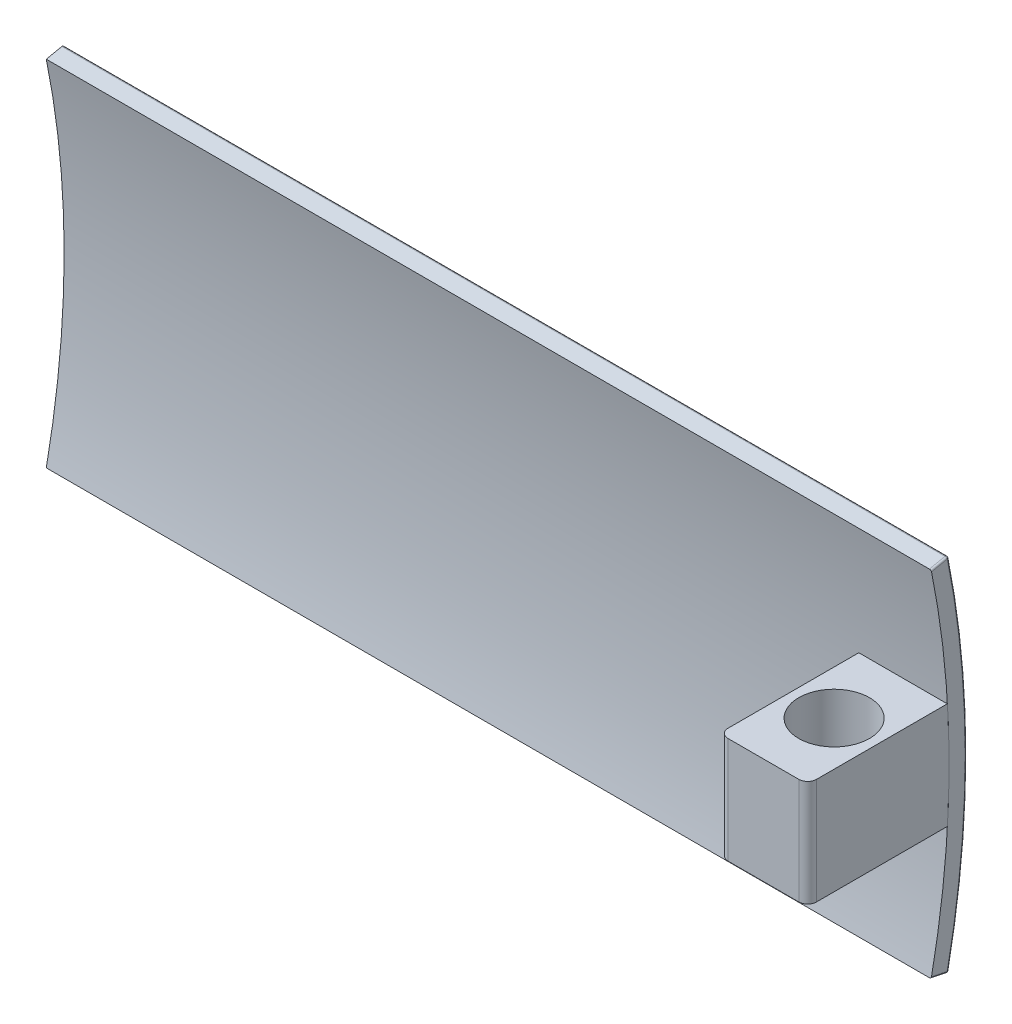
from build123d import *

# Parameters (mm, degrees)
BOSS_EXTRUDE1_DEPTH     = 50
FILLET3_R               = 0.1
BOSS_EXTRUDE2_DEPTH     = 5
CUT_EXTRUDE1_DEPTH      = 73.143420695
CUT_EXTRUDE1_DEPTH_BACK = 73.143420695
CUTOUT_HINGE_R          = 2
FILLET4_R               = 0.5


with BuildPart() as part:
    # airflap → Boss-Extrude1 (new body)
    with BuildSketch(Plane(origin=(0, 0, 0), x_dir=(0, 0, -1), z_dir=(1, 0, 0))):
        with BuildLine():
            Line((49.969590753, 10.2), (48.989794856, 10))
            ThreePointArc((48.989794856, 10), (50, 0), (48.989794856, -10))
            Line((48.989794856, -10), (49.969590753, -10.2))
            ThreePointArc((49.969590753, -10.2), (51, 0), (49.969590753, 10.2))
        make_face()
    extrude(amount=BOSS_EXTRUDE1_DEPTH)

    # Fillet3
    fillet3_edges = [part.edges().sort_by_distance(p)[0] for p in [
        (50, 10.1, -49.479692804),
        (50, -10.1, -49.479692804),
        (25, -10.2, -49.969590753),
        (25, 10.2, -49.969590753),
        (50, 0, -51),
    ]]
    fillet(fillet3_edges, radius=FILLET3_R)


with BuildPart() as body_2:
    # inner-hinge → Boss-Extrude2 (new body)
    with BuildSketch(Plane(origin=(50, 0, 0), x_dir=(0, 0, -1), z_dir=(1, 0, 0))):
        with BuildLine():
            Line((49.009696876, 3), (42.009696876, 3))
            Line((42.009696876, 3), (42.009696876, -3))
            Line((42.009696876, -3), (49.009696876, -3))
            Line((49.009696876, -3), (49.909918854, -3))
            ThreePointArc((49.909918854, -3), (50, 0), (49.909918854, 3))
            Line((49.909918854, 3), (49.009696876, 3))
        make_face()
    extrude(amount=-BOSS_EXTRUDE2_DEPTH)

    # cutout-hinge → Cut-Extrude1 (cut, two sides: drawn at the far end of the back side and taken through both)
    with BuildSketch(Plane(origin=(0, 0, 0), x_dir=(1, 0, 0), z_dir=(0, 1, 0)).offset(-CUT_EXTRUDE1_DEPTH_BACK)):
        with Locations((47.5, 46.004848438)):
            Circle(CUTOUT_HINGE_R)
    extrude(amount=CUT_EXTRUDE1_DEPTH + CUT_EXTRUDE1_DEPTH_BACK, mode=Mode.SUBTRACT)

    # Fillet4
    fillet4_edges = [body_2.edges().sort_by_distance(p)[0] for p in [
        (50, 0, -42.009696876),
        (45, 0, -42.009696876),
    ]]
    fillet(fillet4_edges, radius=FILLET4_R)


solid = Compound([part.part, body_2.part])
